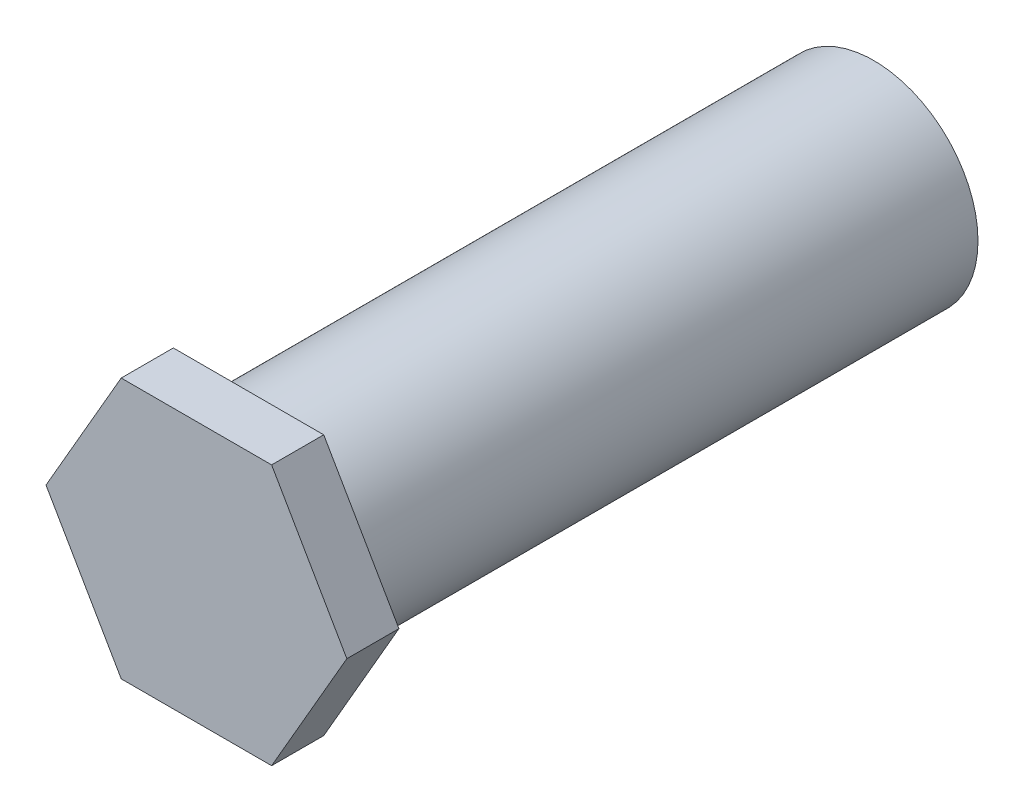
from build123d import *

# Parameters (mm, degrees)
SKETCH1_R      = 10
EXTRUDE1_DEPTH = 60
EXTRUDE2_DEPTH = 5


with BuildPart() as part:
    # Sketch1 → Extrude1 (new body)
    with BuildSketch(Plane.XY):
        Circle(SKETCH1_R)
    extrude(amount=EXTRUDE1_DEPTH)

    # Sketch2 → Extrude2 (add)
    with BuildSketch(Plane.XY.offset(60)):
        Polygon((14.43375673, 0), (7.216878365, 12.5), (-7.216878365, 12.5), (-14.43375673, 0), (-7.216878365, -12.5), (7.216878365, -12.5), align=None)
    extrude(amount=EXTRUDE2_DEPTH)


solid = part.part
